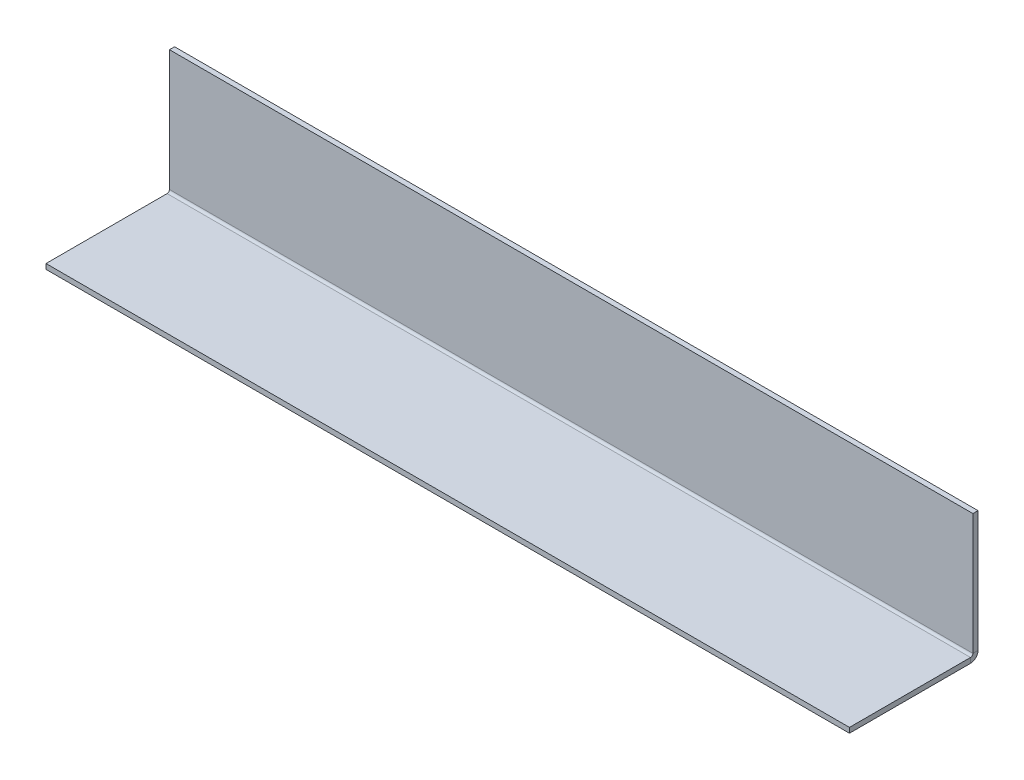
from build123d import *

# Parameters (mm, degrees)
SKETCH1_W                    = 250
SKETCH1_H                    = 1.5875
BASE_FLANGE1_DEPTH           = 40
EDGE_FLANGE1_STRIP_W         = 7.8232
EDGE_FLANGE1_STRIP_H         = 1.5875
EDGE_FLANGE1_STRIP_CUT_DEPTH = 250
EDGE_FLANGE1_DEPTH           = 250


# Sheet-metal steps are written as plain solids
with BuildPart() as part:
    # Sketch1 → Base-Flange1 (new body)
    with BuildSketch(Plane.XY):
        with Locations((0, -0.79375)):
            Rectangle(SKETCH1_W, SKETCH1_H)
    extrude(amount=BASE_FLANGE1_DEPTH)

    # Edge-Flange1 strip (across the edge) → Edge-Flange1 strip cut (cut)
    with BuildSketch(Plane.ZY.offset(-125)):
        with Locations((-1.5875, -0.79375)):
            Rectangle(EDGE_FLANGE1_STRIP_W, EDGE_FLANGE1_STRIP_H)
    extrude(amount=EDGE_FLANGE1_STRIP_CUT_DEPTH, mode=Mode.SUBTRACT)

    # Edge-Flange1 section (across the edge) → Edge-Flange1 (add)
    with BuildSketch(Plane.ZY.offset(-125)):
        with BuildLine():
            Line((0, 0.7366), (0, 38.4125))
            Line((0, 38.4125), (1.5875, 38.4125))
            Line((1.5875, 38.4125), (1.5875, 0.7366))
            ThreePointArc((1.5875, 0.7366), (1.803245145, 0.215745145), (2.3241, 0))
            Line((2.3241, 0), (2.3241, -1.5875))
            ThreePointArc((2.3241, -1.5875), (0.68071313, -0.90678687), (0, 0.7366))
        make_face()
    extrude(amount=EDGE_FLANGE1_DEPTH)


solid = part.part
